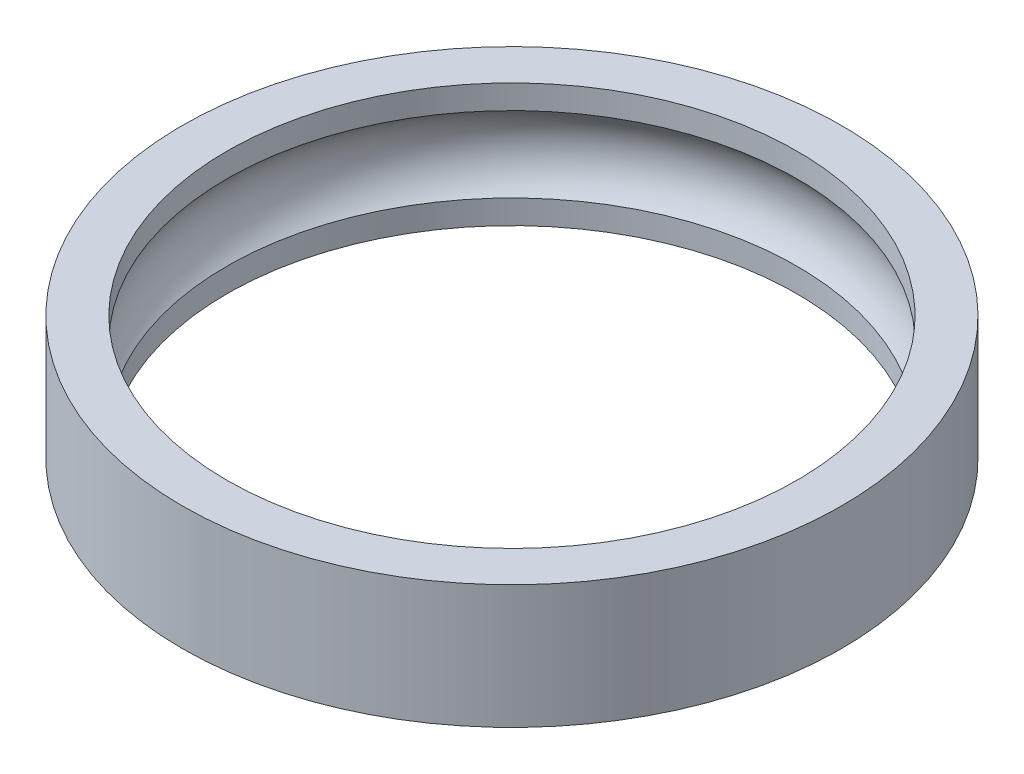
from build123d import *

# Parameters (mm, degrees)
SKETCH1_R           = 40
SKETCH1_R_2         = 34.6
BOSS_EXTRUDE1_DEPTH = 7.5


# Read off the part's stored shape, not the designer's step: Cut-Sweep1
with BuildPart() as part:
    # Sketch1 → Boss-Extrude1 (new, symmetric)
    with BuildSketch(Plane(origin=(0, 0, 0), x_dir=(1, 0, 0), z_dir=(0, 1, 0))):
        with Locations(Location((0, 0, 0), (0, 0, 270))):
            Circle(SKETCH1_R)
        with Locations(Location((0, 0, 0), (0, 0, 270))):
            Circle(SKETCH1_R_2, mode=Mode.SUBTRACT)
    extrude(amount=BOSS_EXTRUDE1_DEPTH, both=True)

    # Cut-Sweep1 outline → Cut-Sweep1 (revolve, cut)
    with BuildSketch(Plane.XY):
        with BuildLine():
            Line((34.6, 4.592385001), (34.6, -4.592385001))
            ThreePointArc((34.6, -4.592385001), (36.5, 0), (34.6, 4.592385001))
        make_face()
    revolve(axis=Axis((0, 0, 0), (0, 1, 0)), mode=Mode.SUBTRACT)


solid = part.part
